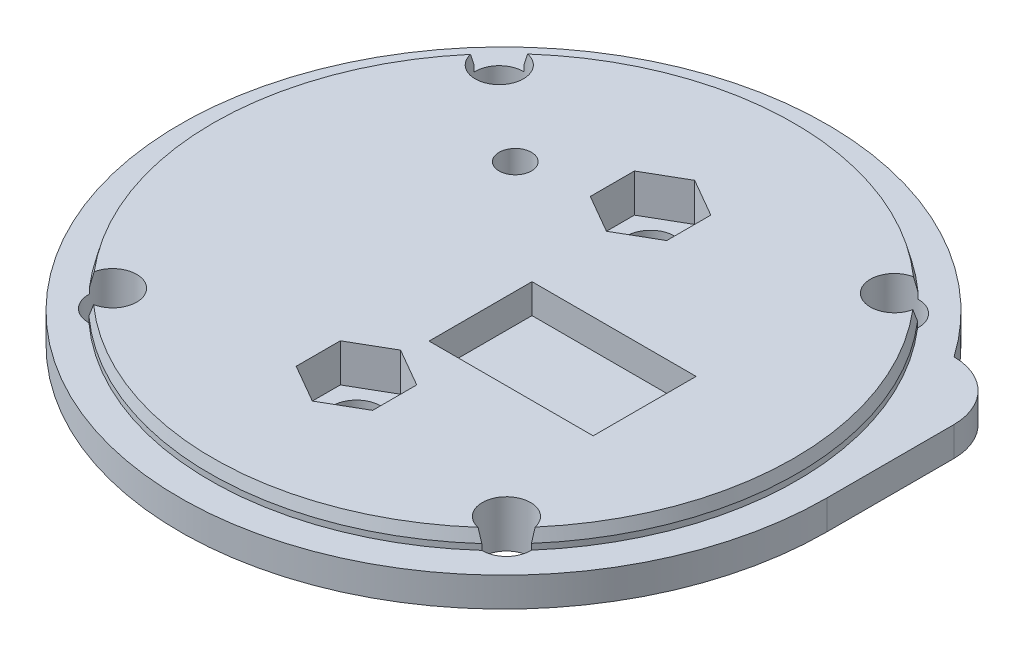
from build123d import *
from OCP.BRepFilletAPI import BRepFilletAPI_MakeChamfer

# Parameters (mm, degrees)
SKETCH_1_R          = 55
EXTRUDE_1_DEPTH     = 5
SKETCH_2_R          = 49.9
EXTRUDE_2_DEPTH     = 3
SKETCH_3_W          = 35
SKETCH_3_H          = 30
EXTRUDE_3_DEPTH     = 25
SKETCH_5_R          = 4.1
CUT_EXTRUDE_2_DEPTH = 82.700673192
SKETCH_6_R          = 2.75
CUT_EXTRUDE_3_DEPTH = 85.492603227
BOSS_EXTRUDE1_DEPTH = 5
FILLET1_R           = 10
SKETCH2_W           = 20.25
SKETCH2_H           = 10.35
CUT_EXTRUDE1_DEPTH  = 95.372930441
SKETCH3_W           = 27.9
SKETCH3_H           = 17.5
CUT_EXTRUDE2_DEPTH  = 5
CHAMFER1_SIZE       = 2
CHAMFER1_SIZE2      = 0.535898385
SKETCH4_W           = 35
SKETCH4_H           = 30
CUT_EXTRUDE3_DEPTH  = 12.5
BOSS_EXTRUDE2_START = -2
SKETCH5_W           = 20
SKETCH5_H           = 70
BOSS_EXTRUDE2_DEPTH = 5.325
SKETCH6_R           = 4.1
CUT_EXTRUDE4_DEPTH  = 79.914863161
CUT_EXTRUDE5_DEPTH  = 6.5


with BuildPart() as part:
    # Эскиз1 → Бобышка-Вытянуть1 (new body)
    with BuildSketch(Plane(origin=(0, 0, 0), x_dir=(1, 0, 0), z_dir=(0, 1, 0))):
        with Locations(Location((0, 0, 0), (0, 0, 270))):
            Circle(SKETCH_1_R)
    extrude(amount=EXTRUDE_1_DEPTH)

    # Эскиз2 → Бобышка-Вытянуть2 (add)
    with BuildSketch(Plane(origin=(0, 5, 0), x_dir=(1, 0, 0), z_dir=(0, 1, 0))):
        with Locations(Location((0, 0, 0), (0, 0, 270))):
            Circle(SKETCH_2_R)
    extrude(amount=EXTRUDE_2_DEPTH)

    # Эскиз3 → Бобышка-Вытянуть3 (add)
    with BuildSketch(Plane.XZ):
        Rectangle(SKETCH_3_W, SKETCH_3_H)
    extrude(amount=EXTRUDE_3_DEPTH)

    # Эскиз5 → Вырез-Вытянуть2 (cut, through all)
    with BuildSketch(Plane.XZ):
        with Locations(Location((33.592198598, -32.871936263, 0), (0, 0, 270))):
            Circle(SKETCH_5_R)
        with Locations(Location((-33.591727056, -32.872418125, 0), (0, 0, 270))):
            Circle(SKETCH_5_R)
        with Locations(Location((-33.591727056, 32.872418125, 0), (0, 0, 270))):
            Circle(SKETCH_5_R)
        with Locations(Location((33.483215177, 32.983215177, 0), (0, 0, 270))):
            Circle(SKETCH_5_R)
    extrude(amount=-CUT_EXTRUDE_2_DEPTH, mode=Mode.SUBTRACT)

    # Эскиз6 → Вырез-Вытянуть3 (cut, through all)
    with BuildSketch(Plane(origin=(0, 8, 0), x_dir=(1, 0, 0), z_dir=(0, 1, 0))):
        with Locations(Location((-17.999856554, 19.999999999, 0), (0, 0, 270))):
            Circle(SKETCH_6_R)
    extrude(amount=-CUT_EXTRUDE_3_DEPTH, mode=Mode.SUBTRACT)

    # Sketch1 → Boss-Extrude1 (add)
    with BuildSketch(Plane.XZ):
        with BuildLine():
            Line((55, 0), (55, -31.546703999))
            Line((55, -31.546703999), (45.053362436, -31.546703999))
            ThreePointArc((45.053362436, -31.546703999), (52.454432291, -16.538818973), (55, 0))
        make_face()
    extrude(amount=-BOSS_EXTRUDE1_DEPTH)

    # Fillet1
    # the kernel refuses this fillet: 10 mm, written as the material it takes off along each edge
    with BuildSketch(Plane(origin=(55, -25, -31.546703999), x_dir=(0, 0, 1), z_dir=(0, 1, 0))) as fillet1_piece_1_section:
        with BuildLine():
            CenterArc((FILLET1_R, -FILLET1_R), FILLET1_R, 90, 90)
            Line((0, -FILLET1_R), (0, 0))
            Line((0, 0), (FILLET1_R, 0))
        make_face()
    fillet1_piece_1 = extrude(amount=55, mode=Mode.PRIVATE)
    fillet1_piece_1 = fillet1_piece_1 - Plane(origin=(0, 2.5, 0), x_dir=(0, 0, 1), z_dir=(0, -1, 0)) * Cylinder(55, 150, mode=Mode.PRIVATE)
    add(fillet1_piece_1, mode=Mode.SUBTRACT)

    # Sketch2 → Cut-Extrude1 (cut, through all)
    with BuildSketch(Plane.ZY.offset(17.5)):
        with Locations((0, -12.5)):
            Rectangle(SKETCH2_W, SKETCH2_H)
    extrude(amount=-CUT_EXTRUDE1_DEPTH, mode=Mode.SUBTRACT)

    # Sketch3 → Cut-Extrude2 (cut)
    with BuildSketch(Plane(origin=(0, 8, 0), x_dir=(1, 0, 0), z_dir=(0, 1, 0))):
        with Locations((15.042136476, -5)):
            Rectangle(SKETCH3_W, SKETCH3_H)
    extrude(amount=-CUT_EXTRUDE2_DEPTH, mode=Mode.SUBTRACT)

    # Chamfer1: one chamfer whose edges measure the first distance from different faces: ONE call of the kernel's chamfer builder (chamfer() names one face for all edges)
    chamfer1_edges_1 = [part.edges().sort_by_distance(p)[0] for p in [
        (0.000357897, 8, -49.899999999),
    ]]
    chamfer1_side_1 = [part.faces().sort_by_distance(p)[0] for p in [
        (0.000357897, 6.5, -49.899999999),
    ]]
    chamfer1_edges_2 = [part.edges().sort_by_distance(p)[0] for p in [
        (-49.9, 8, 0),
    ]]
    chamfer1_side_2 = [part.faces().sort_by_distance(p)[0] for p in [
        (-49.9, 6.5, 0),
    ]]
    chamfer1_edges_3 = [part.edges().sort_by_distance(p)[0] for p in [
        (-0.08242255, 8, 49.899931929),
    ]]
    chamfer1_side_3 = [part.faces().sort_by_distance(p)[0] for p in [
        (-0.08242255, 6.5, 49.899931929),
    ]]
    chamfer1_edges_4 = [part.edges().sort_by_distance(p)[0] for p in [
        (49.899931657, 8, 0.082587101),
    ]]
    chamfer1_side_4 = [part.faces().sort_by_distance(p)[0] for p in [
        (49.899931657, 6.5, 0.082587101),
    ]]
    chamfer1 = BRepFilletAPI_MakeChamfer(part.part.solid().wrapped)
    for e in chamfer1_edges_1:
        chamfer1.Add(CHAMFER1_SIZE, CHAMFER1_SIZE2, e.wrapped, chamfer1_side_1[0].wrapped)  # the first distance lies on this face
    for e in chamfer1_edges_2:
        chamfer1.Add(CHAMFER1_SIZE, CHAMFER1_SIZE2, e.wrapped, chamfer1_side_2[0].wrapped)  # the first distance lies on this face
    for e in chamfer1_edges_3:
        chamfer1.Add(CHAMFER1_SIZE, CHAMFER1_SIZE2, e.wrapped, chamfer1_side_3[0].wrapped)  # the first distance lies on this face
    for e in chamfer1_edges_4:
        chamfer1.Add(CHAMFER1_SIZE, CHAMFER1_SIZE2, e.wrapped, chamfer1_side_4[0].wrapped)  # the first distance lies on this face
    add(Compound.cast(chamfer1.Shape()), mode=Mode.REPLACE)

    # Sketch4 → Cut-Extrude3 (cut)
    with BuildSketch(Plane.XZ.offset(25)):
        Rectangle(SKETCH4_W, SKETCH4_H)
    extrude(amount=-CUT_EXTRUDE3_DEPTH, mode=Mode.SUBTRACT)

    # Sketch5 → Boss-Extrude2 (add)
    with BuildSketch(Plane.XZ.offset(7.325).offset(BOSS_EXTRUDE2_START)):
        Rectangle(SKETCH5_W, SKETCH5_H)
    extrude(amount=-BOSS_EXTRUDE2_DEPTH)

    # Sketch6 → Cut-Extrude4 (cut, through all)
    with BuildSketch(Plane.XZ.offset(5.325)):
        with Locations(Location((0, 25, 0), (0, 0, 270))):
            Circle(SKETCH6_R)
        with Locations(Location((0, -25, 0), (0, 0, 270))):
            Circle(SKETCH6_R)
    extrude(amount=-CUT_EXTRUDE4_DEPTH, mode=Mode.SUBTRACT)

    # Sketch7 → Cut-Extrude5 (cut)
    with BuildSketch(Plane(origin=(0, 8, 0), x_dir=(1, 0, 0), z_dir=(0, 1, 0))):
        Polygon((0, -32.5), (6.495190528, -28.75), (6.495190528, -21.25), (0, -17.5), (-6.495190528, -21.25), (-6.495190528, -28.75), align=None)
        Polygon((0, 17.5), (6.495190528, 21.25), (6.495190528, 28.75), (0, 32.5), (-6.495190528, 28.75), (-6.495190528, 21.25), align=None)
    extrude(amount=-CUT_EXTRUDE5_DEPTH, mode=Mode.SUBTRACT)


solid = part.part
